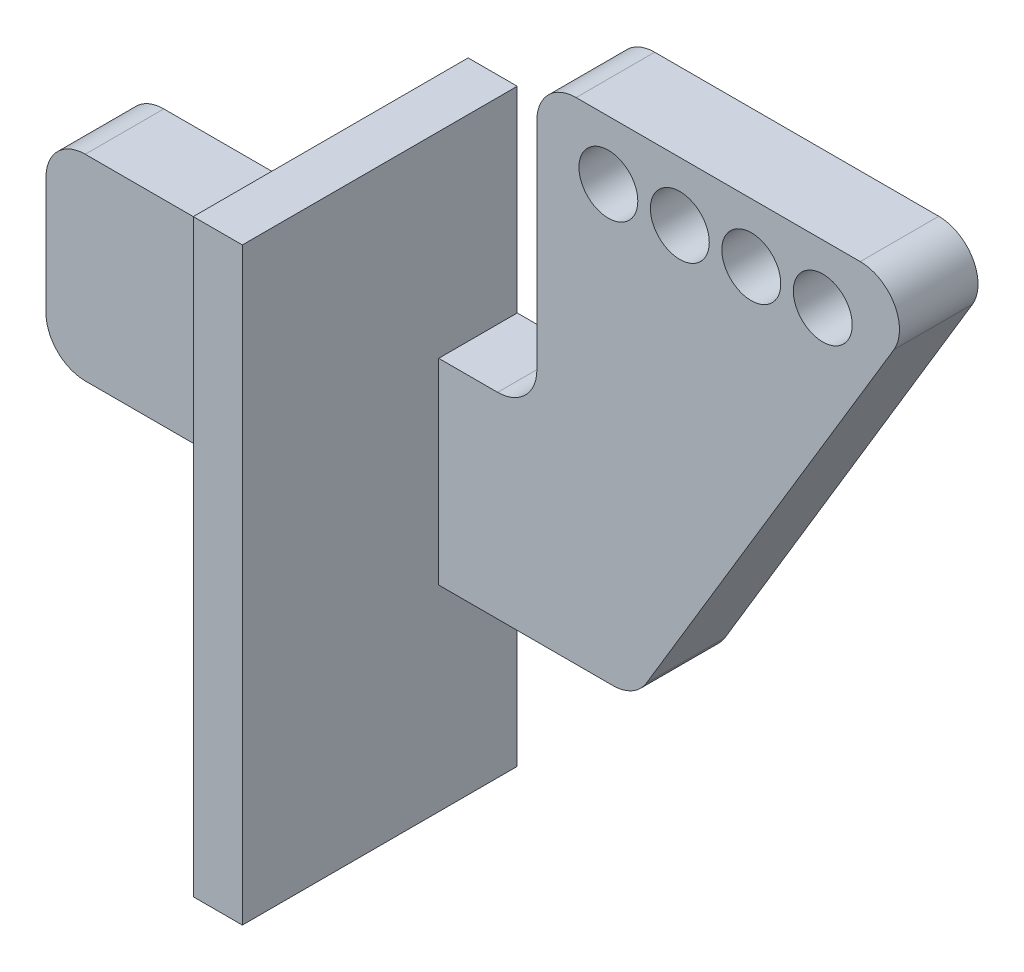
from build123d import *

# Parameters (mm, degrees)
ESQUISSE1_R        = 1.5
BOSS_EXTRU_1_DEPTH = 4
ESQUISSE2_W        = 2.5
ESQUISSE2_H        = 30
BOSS_EXTRU_2_DEPTH = 10
CONG_1_R           = 2


with BuildPart() as part:
    # Esquisse1 → Boss.-Extru.1 (new body)
    with BuildSketch(Plane.XY):
        Polygon((0, 0), (0, 15), (20, 15), (5, -10), (-5, -10), (-5, -20), (-7.5, -20), (-7.5, -10), (-25, -10), (-25, 0), (-7.5, 0), (-7.5, 10), (-5, 10), (-5, 0), align=None)
        with Locations((3.64, 12)):
            Circle(ESQUISSE1_R, mode=Mode.SUBTRACT)
        with Locations((7.28, 12)):
            Circle(ESQUISSE1_R, mode=Mode.SUBTRACT)
        with Locations((10.92, 12)):
            Circle(ESQUISSE1_R, mode=Mode.SUBTRACT)
        with Locations((14.56, 12)):
            Circle(ESQUISSE1_R, mode=Mode.SUBTRACT)
    extrude(amount=BOSS_EXTRU_1_DEPTH)

    # Esquisse2 → Boss.-Extru.2 (add)
    with BuildSketch(Plane.XY.offset(4)):
        with Locations((-6.25, -5)):
            Rectangle(ESQUISSE2_W, ESQUISSE2_H)
    extrude(amount=BOSS_EXTRU_2_DEPTH)

    # Congé1
    cong_1_edges = [part.edges().sort_by_distance(p)[0] for p in [
        (-25, -10, 2),
        (-25, 0, 2),
        (0, 0, 2),
        (0, 15, 2),
        (20, 15, 2),
        (5, -10, 2),
    ]]
    fillet(cong_1_edges, radius=CONG_1_R)


solid = part.part
